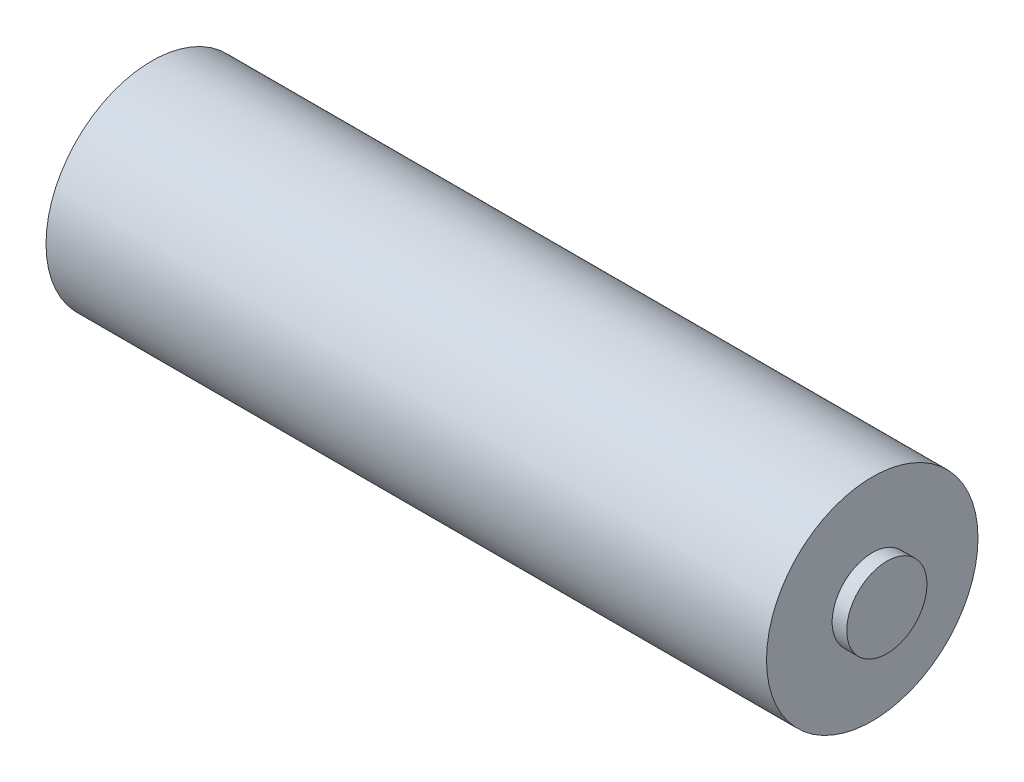
from build123d import *

# Parameters (mm, degrees)
SKETCH1_R           = 7.25
BOSS_EXTRUDE1_DEPTH = 49.4
SKETCH2_R           = 2.75
BOSS_EXTRUDE2_DEPTH = 1
SKETCH3_R           = 3.5
BOSS_EXTRUDE3_DEPTH = 0.1
FILLET1_R           = 0.2


with BuildPart() as part:
    # Sketch1 → Boss-Extrude1 (new body)
    with BuildSketch(Plane(origin=(0, 0, 0), x_dir=(0, 0, -1), z_dir=(1, 0, 0))):
        Circle(SKETCH1_R)
    extrude(amount=BOSS_EXTRUDE1_DEPTH)

    # Sketch2 → Boss-Extrude2 (add)
    with BuildSketch(Plane(origin=(49.4, 0, 0), x_dir=(0, 0, -1), z_dir=(1, 0, 0))):
        Circle(SKETCH2_R)
    extrude(amount=BOSS_EXTRUDE2_DEPTH)

    # Sketch3 → Boss-Extrude3 (add)
    with BuildSketch(Plane.ZY):
        with Locations(Location((0, 0, 0), (0, 0, 180))):
            Circle(SKETCH3_R)
    extrude(amount=BOSS_EXTRUDE3_DEPTH)

    # Fillet1
    # the kernel refuses this fillet: 0.2 mm, written as the material it adds along each edge
    with BuildSketch(Plane(origin=(0, 0, 0), x_dir=(0, 0, -1), z_dir=(0, 1, 0))) as fillet1_piece_1:
        with BuildLine():
            CenterArc((3.673205081, 0.2), FILLET1_R, 210, 60)
            Line((3.5, 0.1), (3.496535898, 0.098))
            ThreePointArc((3.496535898, 0.098), (3.496, 0.05), (3.496, 0))
            Line((3.496, 0), (3.5, -0.004))
            Line((3.5, -0.004), (3.673205081, -0.004))
            Line((3.673205081, -0.004), (3.673205081, 0))
        make_face()
    revolve(axis=Axis((0, 0, 0), (-1, 0, 0)))


solid = part.part
